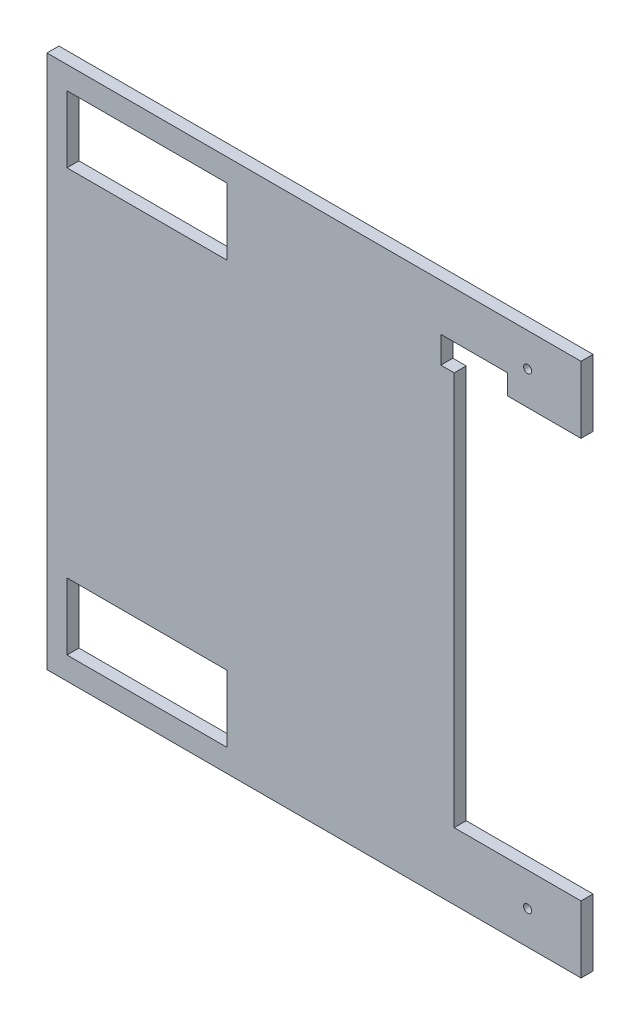
from build123d import *

# Parameters (mm, degrees)
SKETCH1_W           = 400
SKETCH1_H           = 400
SKETCH1_W_2         = 120
SKETCH1_H_2         = 50
BOSS_EXTRUDE1_DEPTH = 9
SKETCH2_W           = 95
SKETCH2_H           = 300
CUT_EXTRUDE1_DEPTH  = 566.757014981
SKETCH3_W           = 40
SKETCH3_H           = 15
CUT_EXTRUDE2_DEPTH  = 10
SKETCH4_W           = 10
SKETCH4_H           = 20
CUT_EXTRUDE3_DEPTH  = 100
SKETCH5_R           = 3
CUT_EXTRUDE4_DEPTH  = 566.757014981


with BuildPart() as part:
    # Sketch1 → Boss-Extrude1 (new body)
    with BuildSketch(Plane.XY):
        with Locations((-200, -200)):
            Rectangle(SKETCH1_W, SKETCH1_H)
        with Locations((-325, -42)):
            Rectangle(SKETCH1_W_2, SKETCH1_H_2, mode=Mode.SUBTRACT)
        with Locations((-325, -358)):
            Rectangle(SKETCH1_W_2, SKETCH1_H_2, mode=Mode.SUBTRACT)
    extrude(amount=BOSS_EXTRUDE1_DEPTH)

    # Sketch2 → Cut-Extrude1 (cut, through all)
    with BuildSketch(Plane(origin=(0, 0, 0), x_dir=(-1, 0, 0), z_dir=(0, 0, -1))):
        with Locations((47.5, -200)):
            Rectangle(SKETCH2_W, SKETCH2_H)
    extrude(amount=-CUT_EXTRUDE1_DEPTH, mode=Mode.SUBTRACT)

    # Sketch3 → Cut-Extrude2 (cut)
    with BuildSketch(Plane(origin=(0, 0, 0), x_dir=(-1, 0, 0), z_dir=(0, 0, -1))):
        with Locations((75, -42.5)):
            Rectangle(SKETCH3_W, SKETCH3_H)
    extrude(amount=-CUT_EXTRUDE2_DEPTH, mode=Mode.SUBTRACT)

    # Sketch4 → Cut-Extrude3 (cut)
    with BuildSketch(Plane(origin=(0, 0, 0), x_dir=(-1, 0, 0), z_dir=(0, 0, -1))):
        with Locations((100, -45)):
            Rectangle(SKETCH4_W, SKETCH4_H)
    extrude(amount=-CUT_EXTRUDE3_DEPTH, mode=Mode.SUBTRACT)

    # Sketch5 → Cut-Extrude4 (cut, through all)
    with BuildSketch(Plane(origin=(0, 0, 0), x_dir=(-1, 0, 0), z_dir=(0, 0, -1))):
        with Locations((40, -25)):
            Circle(SKETCH5_R)
        with Locations((40, -375)):
            Circle(SKETCH5_R)
    extrude(amount=-CUT_EXTRUDE4_DEPTH, mode=Mode.SUBTRACT)


solid = part.part
